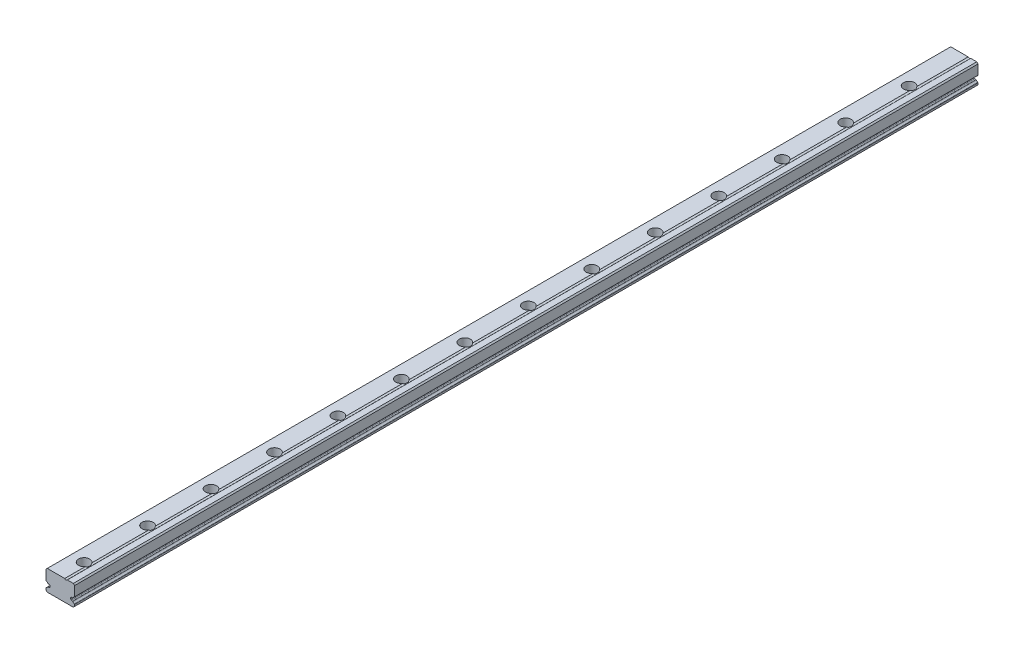
from build123d import *

# Parameters (mm, degrees)
BOSS_EXTRUDE1_START = -144.36216
BOSS_EXTRUDE1_DEPTH = 284.72432
SKETCH2_R           = 1.75
CUT_EXTRUDE1_DEPTH  = 409.901966471
SKETCH2_3_R         = 3
CUT_EXTRUDE2_DEPTH  = 3.5


# Read off the part's stored shape, not the designer's step: Boss-Extrude1
with BuildPart() as part:
    # Boss-Extrude1 outline → Boss-Extrude1 (new body)
    with BuildSketch(Plane.XY.offset(BOSS_EXTRUDE1_START)):
        with BuildLine():
            ThreePointArc((-375.815535559, 396.401159064), (-376.215535559, 396.201159064), (-376.615535559, 396.401159064))
            Line((-376.615535559, 396.401159064), (-382.115535559, 396.401159064))
            Line((-382.115535559, 396.401159064), (-382.515535559, 396.001159064))
            Line((-382.515535559, 396.001159064), (-382.515535559, 392.959462588))
            ThreePointArc((-382.515535559, 392.959462588), (-382.490644208, 392.876710995), (-382.424231211, 392.82142339))
            ThreePointArc((-382.424231211, 392.82142339), (-382.156798336, 392.653535157), (-381.955046042, 392.410630209))
            ThreePointArc((-381.955046042, 392.410630209), (-381.905872585, 392.360101643), (-381.839045976, 392.337621226))
            Line((-381.839045976, 392.337621226), (-381.498104411, 392.307792704))
            ThreePointArc((-381.498104411, 392.307792704), (-381.368080092, 392.243671806), (-381.315535559, 392.108553765))
            Line((-381.315535559, 392.108553765), (-381.315535559, 391.693764363))
            ThreePointArc((-381.315535559, 391.693764363), (-381.368080092, 391.558646322), (-381.498104411, 391.494525424))
            Line((-381.498104411, 391.494525424), (-381.839049723, 391.464696574))
            ThreePointArc((-381.839049723, 391.464696574), (-381.905875926, 391.442216412), (-381.9550493, 391.391688416))
            ThreePointArc((-381.9550493, 391.391688416), (-382.156800742, 391.148786865), (-382.424231211, 390.980900738))
            ThreePointArc((-382.424231211, 390.980900738), (-382.490644208, 390.925613133), (-382.515535559, 390.84286154))
            Line((-382.515535559, 390.84286154), (-382.515535559, 390.301159064))
            Line((-382.515535559, 390.301159064), (-382.115535559, 389.901159064))
            Line((-382.115535559, 389.901159064), (-373.915535559, 389.901159064))
            Line((-373.915535559, 389.901159064), (-373.515535559, 390.301159064))
            Line((-373.515535559, 390.301159064), (-373.515535559, 390.84286154))
            ThreePointArc((-373.515535559, 390.84286154), (-373.540426911, 390.925613132), (-373.606839907, 390.980900738))
            ThreePointArc((-373.606839907, 390.980900738), (-373.874270377, 391.148786865), (-374.076021819, 391.391688416))
            ThreePointArc((-374.076021819, 391.391688416), (-374.125195193, 391.442216412), (-374.192021396, 391.464696574))
            Line((-374.192021396, 391.464696574), (-374.532966708, 391.494525424))
            ThreePointArc((-374.532966708, 391.494525424), (-374.662991027, 391.558646322), (-374.715535559, 391.693764363))
            Line((-374.715535559, 391.693764363), (-374.715535559, 392.108553765))
            ThreePointArc((-374.715535559, 392.108553765), (-374.662991027, 392.243671806), (-374.532966708, 392.307792704))
            Line((-374.532966708, 392.307792704), (-374.192025143, 392.337621226))
            ThreePointArc((-374.192025143, 392.337621226), (-374.125198533, 392.360101643), (-374.076025076, 392.410630209))
            ThreePointArc((-374.076025076, 392.410630209), (-373.874272783, 392.653535157), (-373.606839907, 392.82142339))
            ThreePointArc((-373.606839907, 392.82142339), (-373.540426911, 392.876710996), (-373.515535559, 392.959462588))
            Line((-373.515535559, 392.959462588), (-373.515535559, 396.001159064))
            Line((-373.515535559, 396.001159064), (-373.915535559, 396.401159064))
            Line((-373.915535559, 396.401159064), (-375.815535559, 396.401159064))
        make_face()
    extrude(amount=BOSS_EXTRUDE1_DEPTH)

    # Sketch2 → Cut-Extrude1 (cut, through all)
    with BuildSketch(Plane.XZ.offset(-389.901159064)):
        with Locations(Location((-378.015535559, 132.86216, 0), (0, 0, 270))):
            Circle(SKETCH2_R)
        with Locations(Location((-378.015535559, 112.86216, 0), (0, 0, 270))):
            Circle(SKETCH2_R)
        with Locations(Location((-378.015535559, 92.86216, 0), (0, 0, 270))):
            Circle(SKETCH2_R)
        with Locations(Location((-378.015535559, 72.86216, 0), (0, 0, 270))):
            Circle(SKETCH2_R)
        with Locations(Location((-378.015535559, 52.86216, 0), (0, 0, 270))):
            Circle(SKETCH2_R)
        with Locations(Location((-378.015535559, 32.86216, 0), (0, 0, 270))):
            Circle(SKETCH2_R)
        with Locations(Location((-378.015535559, 12.86216, 0), (0, 0, 270))):
            Circle(SKETCH2_R)
        with Locations(Location((-378.015535559, -7.13784, 0), (0, 0, 270))):
            Circle(SKETCH2_R)
        with Locations(Location((-378.015535559, -27.13784, 0), (0, 0, 270))):
            Circle(SKETCH2_R)
        with Locations(Location((-378.015535559, -47.13784, 0), (0, 0, 270))):
            Circle(SKETCH2_R)
        with Locations(Location((-378.015535559, -67.13784, 0), (0, 0, 270))):
            Circle(SKETCH2_R)
        with Locations(Location((-378.015535559, -87.13784, 0), (0, 0, 270))):
            Circle(SKETCH2_R)
        with Locations(Location((-378.015535559, -107.13784, 0), (0, 0, 270))):
            Circle(SKETCH2_R)
        with Locations(Location((-378.015535559, -127.13784, 0), (0, 0, 270))):
            Circle(SKETCH2_R)
        with Locations((-378.015535559, -147.13784)):
            Circle(SKETCH2_R)
        with Locations((-378.015535559, -167.13784)):
            Circle(SKETCH2_R)
        with Locations((-378.015535559, -187.13784)):
            Circle(SKETCH2_R)
        with Locations((-378.015535559, -207.13784)):
            Circle(SKETCH2_R)
        with Locations((-378.015535559, -227.13784)):
            Circle(SKETCH2_R)
        with Locations((-378.015535559, -247.13784)):
            Circle(SKETCH2_R)
        with Locations((-378.015535559, -267.13784)):
            Circle(SKETCH2_R)
        with Locations((-378.015535559, -287.13784)):
            Circle(SKETCH2_R)
        with Locations((-378.015535559, -307.13784)):
            Circle(SKETCH2_R)
    extrude(amount=-CUT_EXTRUDE1_DEPTH, mode=Mode.SUBTRACT)

    # Sketch2<3> → Cut-Extrude2 (cut)
    with BuildSketch(Plane.XZ.offset(-389.901159064)):
        with Locations(Location((-378.015535559, 132.86216, 0), (0, 0, 270))):
            Circle(SKETCH2_3_R)
        with Locations(Location((-378.015535559, 112.86216, 0), (0, 0, 270))):
            Circle(SKETCH2_3_R)
        with Locations(Location((-378.015535559, 92.86216, 0), (0, 0, 270))):
            Circle(SKETCH2_3_R)
        with Locations(Location((-378.015535559, 72.86216, 0), (0, 0, 270))):
            Circle(SKETCH2_3_R)
        with Locations(Location((-378.015535559, 52.86216, 0), (0, 0, 270))):
            Circle(SKETCH2_3_R)
        with Locations(Location((-378.015535559, 32.86216, 0), (0, 0, 270))):
            Circle(SKETCH2_3_R)
        with Locations(Location((-378.015535559, 12.86216, 0), (0, 0, 270))):
            Circle(SKETCH2_3_R)
        with Locations(Location((-378.015535559, -7.13784, 0), (0, 0, 270))):
            Circle(SKETCH2_3_R)
        with Locations(Location((-378.015535559, -27.13784, 0), (0, 0, 270))):
            Circle(SKETCH2_3_R)
        with Locations(Location((-378.015535559, -47.13784, 0), (0, 0, 270))):
            Circle(SKETCH2_3_R)
        with Locations(Location((-378.015535559, -67.13784, 0), (0, 0, 270))):
            Circle(SKETCH2_3_R)
        with Locations(Location((-378.015535559, -87.13784, 0), (0, 0, 270))):
            Circle(SKETCH2_3_R)
        with Locations(Location((-378.015535559, -107.13784, 0), (0, 0, 270))):
            Circle(SKETCH2_3_R)
        with Locations(Location((-378.015535559, -127.13784, 0), (0, 0, 270))):
            Circle(SKETCH2_3_R)
        with Locations((-378.015535559, -147.13784)):
            Circle(SKETCH2_3_R)
        with Locations((-378.015535559, -167.13784)):
            Circle(SKETCH2_3_R)
    extrude(amount=-CUT_EXTRUDE2_DEPTH, mode=Mode.SUBTRACT)


solid = part.part
